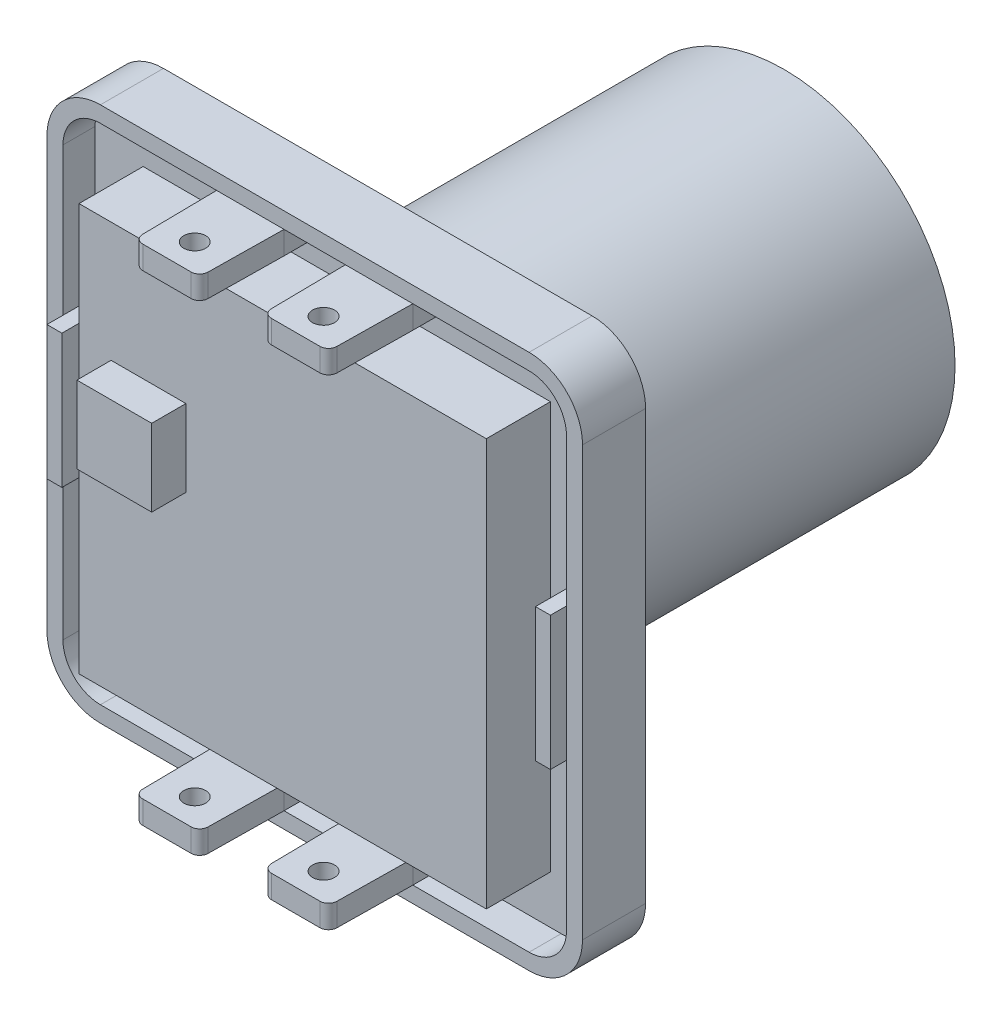
from build123d import *

# Parameters (mm, degrees)
SKETCH_1_W               = 50.1
SKETCH_1_H               = 50.1
EXTRUDE_1_DEPTH          = 5.9
SKETCH_2_W               = 1.4
SKETCH_2_H               = 12.5
EXTRUDE_2_DEPTH          = 1.5
SKETCH_3_W               = 6.31
SKETCH_3_H               = 2.15
EXTRUDE_3_DEPTH          = 7.8
CUT_EXTRUDE_1_DEPTH      = 7.8
SKETCH_6_R               = 1
CUT_EXTRUDE_2_DEPTH      = 7.8
HOLE_WIZARD_M2_5_1_D     = 2.05
FILLET_1_R               = 0.8
MIRROR_3_COPY_1_DEPTH    = 7.8
FILLET_1_OF_MIRROR_3_R   = 0.8
SKETCH_9_W               = 38.1
SKETCH_9_H               = 38.1
EXTRUDE_4_DEPTH          = 3
SKETCH_10_W              = 38.1
SKETCH_10_H              = 38.1
CUT_EXTRUDE_3_DEPTH      = 3
FILLET_2_R               = 5
FILLET_3_R               = 3.5
SKETCH_13_R              = 20
EXTRUDE_5_DEPTH          = 1
CHAMFER_1_SIZE           = 1
SKETCH_14_R              = 18.25
EXTRUDE_6_DEPTH          = 5
EXTRUDE_START            = -6
EXTRUDE_7_DEPTH          = 6
PATTERN_CIRCULAR_1_COUNT = 2
PATTERN_CIRCULAR_1_ANGLE = 90
SKETCH_16_W              = 7
SKETCH_16_H              = 7.2
EXTRUDE_8_DEPTH          = 3.2
SKETCH_17_R              = 16
EXTRUDE_9_DEPTH          = 32
SKETCH_18_R              = 15
CUT_EXTRUDE_4_DEPTH      = 5
DOME_1_FACE_RADIUS       = 15
DOME_1_HEIGHT            = 5


with BuildPart() as part:
    # 草图1 → 凸台-拉伸1 (new body)
    with BuildSketch(Plane.XY):
        Rectangle(SKETCH_1_W, SKETCH_1_H)
    extrude(amount=-EXTRUDE_1_DEPTH)

    # 草图2 → 凸台-拉伸2 (add)
    with BuildSketch(Plane.XY):
        with Locations((22.85, 0)):
            Rectangle(SKETCH_2_W, SKETCH_2_H)
    extrude_2 = extrude(amount=EXTRUDE_2_DEPTH)

    # 镜向1: 凸台-拉伸2 across plane
    add(extrude_2.mirror(Plane(origin=(0, 0, 0), x_dir=(0, 0, 1), z_dir=(1, 0, 0))))

    # 草图3 → 凸台-拉伸3 (add)
    with BuildSketch(Plane.XY):
        with Locations((-6.025, 22.475)):
            Rectangle(SKETCH_3_W, SKETCH_3_H)
        with Locations((6.025, 22.475)):
            Rectangle(SKETCH_3_W, SKETCH_3_H)
    extrude_3 = extrude(amount=EXTRUDE_3_DEPTH)

    # 草图5 → 切除-拉伸1 (cut)
    with BuildSketch(Plane(origin=(0, 23.55, 0), x_dir=(1, 0, 0), z_dir=(0, 1, 0))):
        Polygon((-9.18, 0), (-9.075, -7.8), (-9.18, -7.8), align=None)
        Polygon((-2.87, -7.8), (-2.87, 0), (-2.975, -7.8), align=None)
    cut_extrude_1 = extrude(amount=-CUT_EXTRUDE_1_DEPTH, mode=Mode.SUBTRACT)

    # 镜向2: 切除-拉伸1 across plane
    add(cut_extrude_1.mirror(Plane(origin=(0, 0, 0), x_dir=(0, 0, 1), z_dir=(1, 0, 0))), mode=Mode.SUBTRACT)

    # 草图6 → 切除-拉伸2 (cut)
    with BuildSketch(Plane(origin=(0, 23.55, 0), x_dir=(1, 0, 0), z_dir=(0, 1, 0))):
        with Locations(Location((-6.025, -5.2, 0), (0, 0, 270))):
            Circle(SKETCH_6_R)
        with Locations(Location((6.025, -5.2, 0), (0, 0, 270))):
            Circle(SKETCH_6_R)
    cut_extrude_2 = extrude(amount=-CUT_EXTRUDE_2_DEPTH, mode=Mode.SUBTRACT)

    # M2.5 螺纹孔1 (through all)
    with Locations(Plane(origin=(0, 23.55, 0), x_dir=(1, 0, 0), z_dir=(0, 1, 0))):
        with Locations((-6.025, -5.2), (6.025, -5.2)):
            hole_wizard_m2_5_1 = Hole(HOLE_WIZARD_M2_5_1_D / 2)

    # 圆角1
    fillet_1_edges = [part.edges().sort_by_distance(p)[0] for p in [
        (-2.975, 22.475, 7.8),
        (-9.075, 22.475, 7.8),
        (2.975, 22.475, 7.8),
        (9.075, 22.475, 7.8),
    ]]
    fillet(fillet_1_edges, radius=FILLET_1_R)

    # 镜向3: 凸台-拉伸3, 切除-拉伸1, 切除-拉伸2, M2.5 螺纹孔1 across plane
    add(extrude_3.mirror(Plane.ZX))
    add(cut_extrude_1.mirror(Plane.ZX), mode=Mode.SUBTRACT)
    add(cut_extrude_2.mirror(Plane.ZX), mode=Mode.SUBTRACT)
    add(hole_wizard_m2_5_1.mirror(Plane.ZX), mode=Mode.SUBTRACT)

    # 镜向3 copy 1 sketch → 镜向3 copy 1 (cut)
    with BuildSketch(Plane(origin=(0, -23.55, 0), x_dir=(-1, 0, 0), z_dir=(0, -1, 0))):
        Polygon((-9.18, 0), (-9.075, -7.8), (-9.18, -7.8), align=None)
        Polygon((-2.87, -7.8), (-2.87, 0), (-2.975, -7.8), align=None)
    extrude(amount=-MIRROR_3_COPY_1_DEPTH, mode=Mode.SUBTRACT)

    # 圆角1 of 镜向3
    fillet_1_of_mirror_3_edges = [part.edges().sort_by_distance(p)[0] for p in [
        (-2.975, -22.475, 7.8),
        (-9.075, -22.475, 7.8),
        (2.975, -22.475, 7.8),
        (9.075, -22.475, 7.8),
    ]]
    fillet(fillet_1_of_mirror_3_edges, radius=FILLET_1_OF_MIRROR_3_R)

    # 草图9 → 凸台-拉伸4 (add)
    with BuildSketch(Plane.XY):
        Rectangle(SKETCH_9_W, SKETCH_9_H)
    extrude(amount=EXTRUDE_4_DEPTH)

    # 草图10 → 切除-拉伸3 (cut)
    with BuildSketch(Plane.XY):
        Polygon((-9.18, 23.55), (-23.55, 23.55), (-23.55, 6.25), (-22.15, 6.25), (-22.15, -6.25), (-23.55, -6.25), (-23.55, -23.55), (-9.18, -23.55), (-9.18, -21.4), (-2.87, -21.4), (-2.87, -23.55), (2.87, -23.55), (2.87, -21.4), (9.18, -21.4), (9.18, -23.55), (23.55, -23.55), (23.55, -6.25), (22.15, -6.25), (22.15, 6.25), (23.55, 6.25), (23.55, 23.55), (9.18, 23.55), (9.18, 21.4), (2.87, 21.4), (2.87, 23.55), (-2.87, 23.55), (-2.87, 21.4), (-9.18, 21.4), align=None)
        Rectangle(SKETCH_10_W, SKETCH_10_H, mode=Mode.SUBTRACT)
    extrude(amount=-CUT_EXTRUDE_3_DEPTH, mode=Mode.SUBTRACT)

    # 圆角2
    fillet_2_edges = [part.edges().sort_by_distance(p)[0] for p in [
        (25.05, -25.05, -2.95),
        (-25.05, -25.05, -2.95),
        (-25.05, 25.05, -2.95),
        (25.05, 25.05, -2.95),
    ]]
    fillet(fillet_2_edges, radius=FILLET_2_R)

    # 圆角3
    fillet_3_edges = [part.edges().sort_by_distance(p)[0] for p in [
        (23.55, 23.55, -1.5),
        (23.55, -23.55, -1.5),
        (-23.55, -23.55, -1.5),
        (-23.55, 23.55, -1.5),
    ]]
    fillet(fillet_3_edges, radius=FILLET_3_R)

    # 草图13 → 凸台-拉伸5 (add)
    with BuildSketch(Plane(origin=(0, 0, -5.9), x_dir=(-1, 0, 0), z_dir=(0, 0, -1))):
        Circle(SKETCH_13_R)
    extrude(amount=EXTRUDE_5_DEPTH)

    # 倒角1
    chamfer_1_edges = [part.edges().sort_by_distance(p)[0] for p in [
        (20, 0, -5.9),
    ]]
    chamfer(chamfer_1_edges, length=CHAMFER_1_SIZE - 0.0001)  # a hair under: the kernel refuses the full size

    # 草图14 → 凸台-拉伸6 (add)
    with BuildSketch(Plane(origin=(0, 0, -6.9), x_dir=(-1, 0, 0), z_dir=(0, 0, -1))):
        Circle(SKETCH_14_R)
    extrude(amount=EXTRUDE_6_DEPTH)

    # 草图15 → 凸台-拉伸7 (add)
    with BuildSketch(Plane(origin=(0, 0, -11.9), x_dir=(-1, 0, 0), z_dir=(0, 0, -1)).offset(EXTRUDE_START)):
        Polygon((-18.207999616, -14.67246571), (14.67246571, 18.207999616), (18.207999616, 14.67246571), (-14.67246571, -18.207999616), align=None)
    extrude_7 = extrude(amount=EXTRUDE_7_DEPTH)

    # 阵列(圆周)1: 凸台-拉伸7 ×2 about axis
    pattern_circular_1_axis = Axis((0, 0, 0), (0, 0, 1))
    for i in range(1, PATTERN_CIRCULAR_1_COUNT):
        add(extrude_7.rotate(pattern_circular_1_axis, i * PATTERN_CIRCULAR_1_ANGLE / (PATTERN_CIRCULAR_1_COUNT - 1)))

    # 草图16 → 凸台-拉伸8 (add)
    with BuildSketch(Plane.XY.offset(3)):
        with Locations((-12.55, 4.25)):
            Rectangle(SKETCH_16_W, SKETCH_16_H)
    extrude(amount=EXTRUDE_8_DEPTH)

    # 草图17 → 凸台-拉伸9 (add)
    with BuildSketch(Plane(origin=(0, 0, -11.9), x_dir=(-1, 0, 0), z_dir=(0, 0, -1))):
        Circle(SKETCH_17_R)
    extrude(amount=EXTRUDE_9_DEPTH)

    # 草图18 → 切除-拉伸4 (cut)
    with BuildSketch(Plane(origin=(0, 0, -43.9), x_dir=(-1, 0, 0), z_dir=(0, 0, -1))):
        Circle(SKETCH_18_R)
    extrude(amount=-CUT_EXTRUDE_4_DEPTH, mode=Mode.SUBTRACT)

    # 圆顶1: a dome of height H over a round flat face of radius A is a cap of a sphere of radius (A * A + H * H) / (2 * H)
    dome_1_r = (DOME_1_FACE_RADIUS * DOME_1_FACE_RADIUS + DOME_1_HEIGHT * DOME_1_HEIGHT) / (2 * DOME_1_HEIGHT)
    dome_1_base = Plane((0, 0, -38.9), z_dir=(0, 0, -1))
    with Locations(dome_1_base.offset(DOME_1_HEIGHT - dome_1_r)):
        dome_1_ball = Sphere(dome_1_r, mode=Mode.PRIVATE)
    add(split(dome_1_ball, bisect_by=dome_1_base, keep=Keep.TOP, mode=Mode.PRIVATE))


solid = part.part
